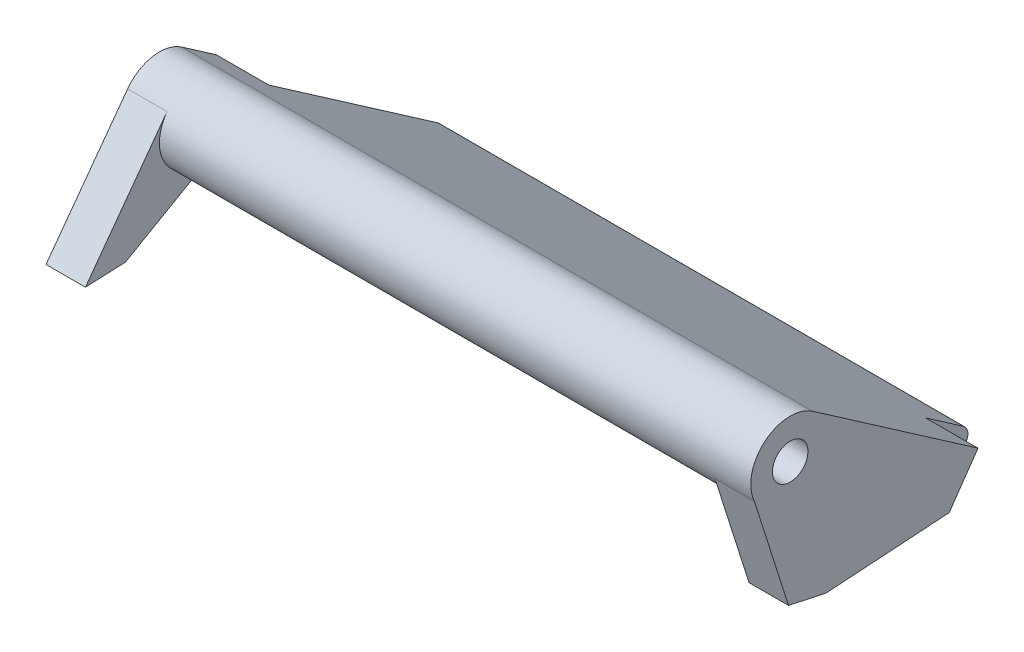
from build123d import *

# Parameters (mm, degrees)
EXTRUDE_1_DEPTH          = 12
CUT_EXTRUDE_1_DEPTH      = 10
CUT_EXTRUDE_1_DEPTH_BACK = 10
SKETCH_2_W               = 2.506204129
SKETCH_2_H               = 10.984391515
EXTRUDE_START            = -1.5
EXTRUDE_2_DEPTH          = 1.5
FILLET_1_R               = 0.4
EXTRUDE_3_DEPTH          = 1.5
EXTRUDE_4_REACH          = 26.208


with BuildPart() as part:
    # 草图1 → 凸台-拉伸1 (new, symmetric)
    with BuildSketch(Plane(origin=(0, 0, 0), x_dir=(0, 0, -1), z_dir=(1, 0, 0))):
        with BuildLine():
            ThreePointArc((0.424459717, 1.438691749), (-1.23881175, -0.84578097), (1.494480371, -0.128562902))
            Line((1.494480371, -0.128562902), (0.897098533, 0.285679978))
            Line((0.897098533, 0.285679978), (0.611565164, 0.285679978))
            ThreePointArc((0.611565164, 0.285679978), (0.658950486, 0.146319025), (0.675, 0))
            ThreePointArc((0.675, 0), (-0.609153227, -0.290787458), (0.424459717, 0.524841832))
            Line((0.424459717, 0.524841832), (0.424459717, 1.438691749))
        make_face()
        with BuildLine():
            Line((8.48773274, -4.977898486), (8.91741162, -4.358256311))
            Line((8.91741162, -4.358256311), (0.854750449, 1.232640122))
            ThreePointArc((0.854750449, 1.232640122), (1.328932969, 0.695655923), (1.5, 0))
            ThreePointArc((1.5, 0), (1.498619458, -0.064340668), (1.494480371, -0.128562902))
            Line((1.494480371, -0.128562902), (8.48773274, -4.977898486))
        make_face()
        with BuildLine():
            ThreePointArc((1.5, 0), (1.328932969, 0.695655923), (0.854750449, 1.232640122))
            ThreePointArc((0.854750449, 1.232640122), (0.647849504, 1.352882485), (0.424459717, 1.438691749))
            Line((0.424459717, 1.438691749), (0.424459717, 0.524841832))
            ThreePointArc((0.424459717, 0.524841832), (0.531635671, 0.415918878), (0.611565164, 0.285679978))
            Line((0.611565164, 0.285679978), (0.897098533, 0.285679978))
            Line((0.897098533, 0.285679978), (1.494480371, -0.128562902))
            ThreePointArc((1.494480371, -0.128562902), (1.498619458, -0.064340668), (1.5, 0))
        make_face()
    extrude(amount=EXTRUDE_1_DEPTH, both=True)

    # 草图2 → 切除-拉伸1 (cut, two sides: drawn at the far end of the back side and taken through both)
    with BuildSketch(Plane(origin=(0, 0, 0), x_dir=(1, 0, 0), z_dir=(0, 1, 0)).offset(-CUT_EXTRUDE_1_DEPTH_BACK)):
        with Locations((-11.255680748, 7.657884592)):
            Rectangle(SKETCH_2_W, SKETCH_2_H)
        with Locations((11.255680748, 7.657884592)):
            Rectangle(SKETCH_2_W, SKETCH_2_H)
    extrude(amount=CUT_EXTRUDE_1_DEPTH + CUT_EXTRUDE_1_DEPTH_BACK, mode=Mode.SUBTRACT)

    # 草图3 → 凸台-拉伸2 (add)
    with BuildSketch(Plane.ZY.offset(12).offset(EXTRUDE_START)):
        with BuildLine():
            Line((1.209536672, 0.887142063), (4.315061937, -3.346956229))
            Line((4.315061937, -3.346956229), (2.791074167, -3.281580786))
            Line((2.791074167, -3.281580786), (-0.41583993, -1.441206839))
            ThreePointArc((-0.41583993, -1.441206839), (1.229955601, -0.858608886), (1.209536672, 0.887142063))
        make_face()
    extrude(amount=EXTRUDE_2_DEPTH)

    # 圆角1
    # the kernel refuses this fillet: 0.4 mm, written as the material it takes off along each edge
    with BuildSketch(Plane(origin=(0, -4.977898486, -8.48773274), x_dir=(0, 0.5698336328652603, 0.8217600810793743), z_dir=(-1, 0, 0)), Plane(origin=(0, -4.358256311, -8.91741162), x_dir=(0, 0.5698336328652598, 0.8217600810793746), z_dir=(1, 0, 0))) as fillet_1_piece_1:
        with BuildLine():
            CenterArc((FILLET_1_R, FILLET_1_R), FILLET_1_R, 180, 90)
            Line((0, FILLET_1_R), (0, 0))
            Line((0, 0), (FILLET_1_R, 0))
        make_face()
    extrude(amount=11.002578683, mode=Mode.SUBTRACT)
    with BuildSketch(Plane(origin=(0, -4.358256311, -8.91741162), x_dir=(0, 0.5698336328652598, 0.8217600810793746), z_dir=(-1, 0, 0)), Plane(origin=(0, -4.977898486, -8.48773274), x_dir=(0, 0.5698336328652603, 0.8217600810793743), z_dir=(1, 0, 0))) as fillet_1_piece_2:
        with BuildLine():
            CenterArc((FILLET_1_R, -FILLET_1_R), FILLET_1_R, 90, 90)
            Line((0, -FILLET_1_R), (0, 0))
            Line((0, 0), (FILLET_1_R, 0))
        make_face()
    extrude(amount=11.002578683, mode=Mode.SUBTRACT)

    # 草图4 → 凸台-拉伸3 (add)
    with BuildSketch(Plane(origin=(12, 0, 0), x_dir=(0, 0, -1), z_dir=(1, 0, 0))):
        with BuildLine():
            Line((-1.361590085, -0.629342864), (-0.064760058, -4.70678049))
            Line((-0.064760058, -4.70678049), (1.358347945, -5.014160577))
            Line((1.358347945, -5.014160577), (6.052641572, -4.70678049))
            Line((6.052641572, -4.70678049), (2.165688834, -0.593999427))
            Line((2.165688834, -0.593999427), (1.494480371, -0.128562902))
            ThreePointArc((1.494480371, -0.128562902), (0.259056171, -1.477460626), (-1.361590085, -0.629342864))
        make_face()
    extrude(amount=-EXTRUDE_3_DEPTH)

    # 凸台-拉伸4: up to this face of the body (flat: up to its plane)
    extrude_4_end = Plane(part.part.faces().sort_by_distance((12, -3.083366952, -2.010931635))[0])
    # 草图5 → 凸台-拉伸4 (add, up to the picked face)
    with BuildSketch(Plane(origin=(10.002578683, 0, 0), x_dir=(0, 0, -1), z_dir=(1, 0, 0)), mode=Mode.PRIVATE) as extrude_4_sk1:
        Polygon((6.052641572, -4.70678049), (2.165688834, -0.593999427), (2.165688834, 0.323595257), (7.146064321, -3.129949789), align=None)
    extrude_4_tool1 = split(extrude(extrude_4_sk1.sketch, amount=EXTRUDE_4_REACH, mode=Mode.PRIVATE), bisect_by=extrude_4_end, keep=Keep.BOTH, mode=Mode.PRIVATE)
    add(extrude_4_tool1.solids().sort_by(Axis((10.002579, -2.305975, -4.731819), (1, 0, 0)))[0])


solid = part.part
